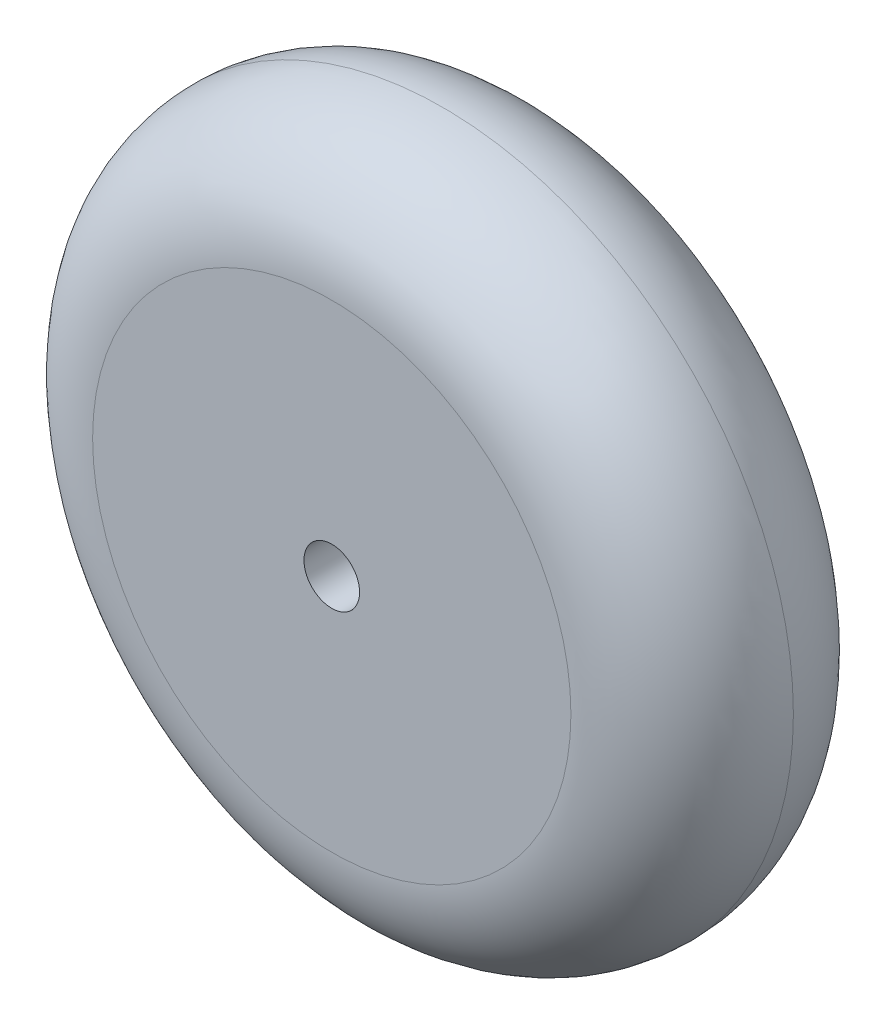
from build123d import *

# Parameters (mm, degrees)
SKETCH1_R           = 40.005
BOSS_EXTRUDE1_DEPTH = 25.4
CUT_EXTRUDE1_REACH  = 64.016
SKETCH2_R           = 3.175
FILLET1_R           = 12.7


with BuildPart() as part:
    # Sketch1 → Boss-Extrude1 (new body)
    with BuildSketch(Plane.XY):
        Circle(SKETCH1_R)
    extrude(amount=BOSS_EXTRUDE1_DEPTH)

    # Sketch2 → Cut-Extrude1 (cut, up to next)
    with BuildSketch(Plane.XY.offset(25.4), mode=Mode.PRIVATE) as cut_extrude1_sk1:
        Circle(SKETCH2_R)
    cut_extrude1_tool1 = extrude(cut_extrude1_sk1.sketch, amount=-CUT_EXTRUDE1_REACH, mode=Mode.PRIVATE) & part.part
    add(cut_extrude1_tool1.solids().sort_by_distance((0, 0, 25.4))[0], mode=Mode.SUBTRACT)

    # Fillet1
    fillet1_edges = [part.edges().sort_by_distance(p)[0] for p in [
        (-40.005, 0, 0),
        (-40.005, 0, 25.4),
    ]]
    fillet(fillet1_edges, radius=FILLET1_R - 0.0001)  # a hair under: the kernel refuses the full size


solid = part.part
